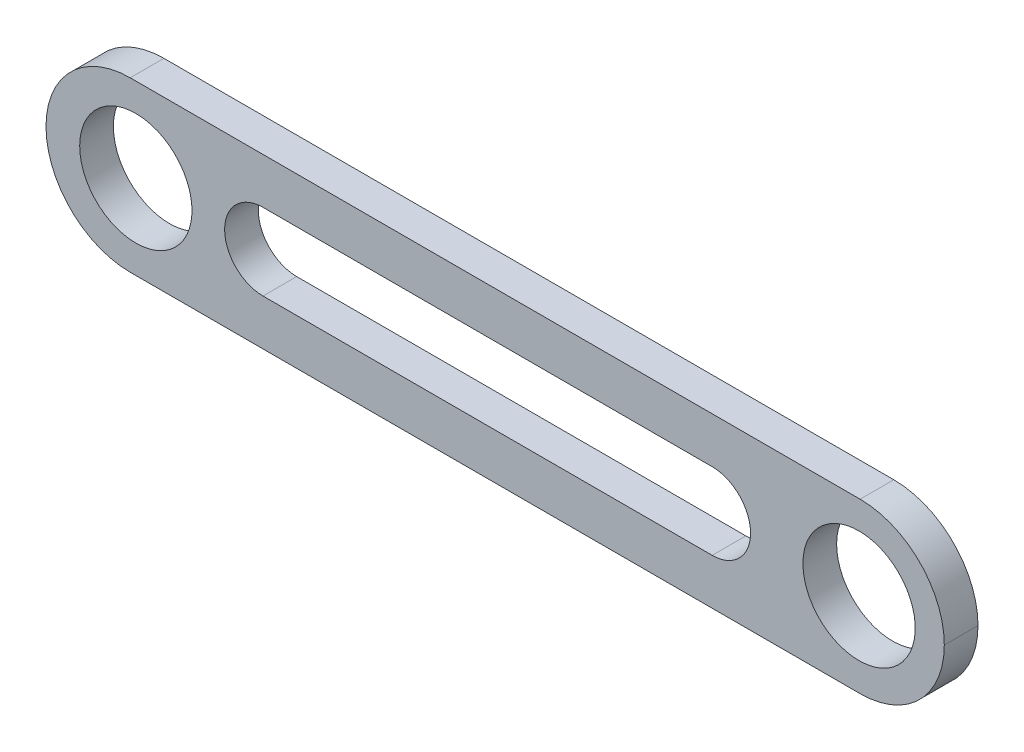
from build123d import *

# Parameters (mm, degrees)
SKETCH1_W           = 203.2
SKETCH1_H           = 38.1
SKETCH1_R           = 12.7
BOSS_EXTRUDE1_DEPTH = 7.62
FILLET1_R           = 19.05


with BuildPart() as part:
    # Sketch1 → Boss-Extrude1 (new body)
    with BuildSketch(Plane.XY):
        Rectangle(SKETCH1_W, SKETCH1_H)
        with Locations(Location((-81.28, 0, 0), (0, 0, 180))):
            Circle(SKETCH1_R, mode=Mode.SUBTRACT)
        with Locations(Location((82.317778023, 0, 0), (0, 0, 180))):
            Circle(SKETCH1_R, mode=Mode.SUBTRACT)
        with BuildLine():
            Line((-52.511607643, 8.682983434), (49.088392357, 8.682983434))
            ThreePointArc((49.088392357, 8.682983434), (57.771375791, 0), (49.088392357, -8.682983434))
            Line((49.088392357, -8.682983434), (-52.511607643, -8.682983434))
            ThreePointArc((-52.511607643, -8.682983434), (-61.194591077, 0), (-52.511607643, 8.682983434))
        make_face(mode=Mode.SUBTRACT)
    extrude(amount=BOSS_EXTRUDE1_DEPTH)

    # Fillet1
    fillet1_edges = [part.edges().sort_by_distance(p)[0] for p in [
        (101.6, -19.05, 3.81),
        (101.6, 19.05, 3.81),
        (-101.6, -19.05, 3.81),
        (-101.6, 19.05, 3.81),
    ]]
    fillet(fillet1_edges, radius=FILLET1_R - 0.0001)  # a hair under: the kernel refuses the full size


solid = part.part
